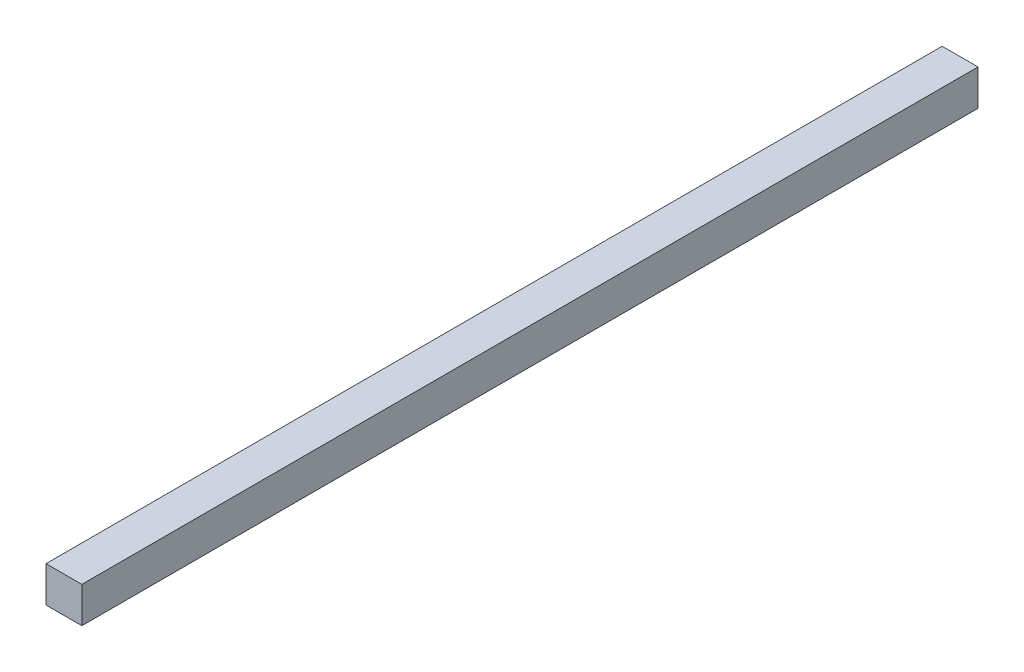
from build123d import *

# Parameters (mm, degrees)
SKETCH1_W           = 25.4
SKETCH1_H           = 25.4
BOSS_EXTRUDE1_DEPTH = 635


with BuildPart() as part:
    # Sketch1 → Boss-Extrude1 (new body)
    with BuildSketch(Plane.XY):
        with Locations((12.7, 12.7)):
            Rectangle(SKETCH1_W, SKETCH1_H)
    extrude(amount=BOSS_EXTRUDE1_DEPTH)


solid = part.part
